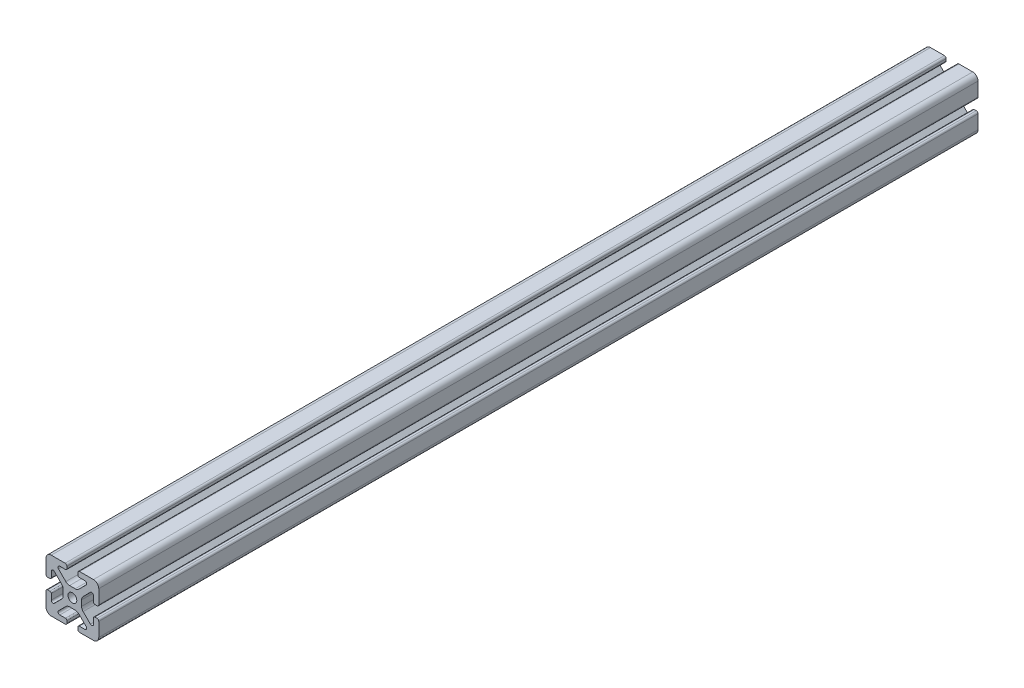
from build123d import *

# Parameters (mm, degrees)
SKETCH1_R           = 2.5
BOSS_EXTRUDE1_DEPTH = 500


with BuildPart() as part:
    # Sketch1 → Boss-Extrude1 (new body)
    with BuildSketch(Plane.XY):
        with BuildLine():
            Line((1.603196264, 5.250000001), (-1.603196256, 5.250000001))
            ThreePointArc((-1.603196256, 5.250000001), (-2.751246551, 5.478361403), (-3.724516596, 6.128679656))
            Line((-3.724516596, 6.128679656), (-7.850557356, 10.254720416))
            ThreePointArc((-7.850557356, 10.254720416), (-8.072177387, 11.368879549), (-7.127638883, 12))
            Line((-7.127638883, 12), (-3.899999993, 12))
            ThreePointArc((-3.899999993, 12), (-3.334314568, 12.234314575), (-3.099999993, 12.8))
            Line((-3.099999993, 12.8), (-3.099999993, 14))
            ThreePointArc((-3.099999993, 14), (-3.392893211, 14.707106781), (-4.099999993, 15))
            Line((-4.099999993, 15), (-11.999999993, 15))
            ThreePointArc((-11.999999993, 15), (-14.121320336, 14.121320343), (-14.999999993, 12))
            Line((-14.999999993, 12), (-14.999999993, 4.1))
            ThreePointArc((-14.999999993, 4.1), (-14.707106774, 3.392893219), (-13.999999993, 3.1))
            Line((-13.999999993, 3.1), (-12.799999993, 3.1))
            ThreePointArc((-12.799999993, 3.1), (-12.234314568, 3.334314575), (-11.999999993, 3.9))
            Line((-11.999999993, 3.9), (-11.999999993, 7.12763889))
            ThreePointArc((-11.999999993, 7.12763889), (-11.368879545, 8.072177389), (-10.254720418, 7.85055736))
            Line((-10.254720418, 7.85055736), (-6.128679658, 3.7245166))
            ThreePointArc((-6.128679658, 3.7245166), (-5.478361404, 2.751246553), (-5.250000001, 1.603196256))
            Line((-5.250000001, 1.603196256), (-5.250000001, -1.603196264))
            ThreePointArc((-5.250000001, -1.603196264), (-5.478361403, -2.751246559), (-6.128679656, -3.724516604))
            Line((-6.128679656, -3.724516604), (-10.254720416, -7.850557364))
            ThreePointArc((-10.254720416, -7.850557364), (-11.368879549, -8.072177394), (-12, -7.12763889))
            Line((-12, -7.12763889), (-12, -3.9))
            ThreePointArc((-12, -3.9), (-12.234314575, -3.334314575), (-12.8, -3.1))
            Line((-12.8, -3.1), (-14, -3.1))
            ThreePointArc((-14, -3.1), (-14.707106781, -3.392893219), (-15, -4.1))
            Line((-15, -4.1), (-15, -12))
            ThreePointArc((-15, -12), (-14.121320344, -14.121320344), (-12, -15))
            Line((-12, -15), (-4.1, -15))
            ThreePointArc((-4.1, -15), (-3.392893219, -14.707106781), (-3.1, -14))
            Line((-3.1, -14), (-3.1, -12.8))
            ThreePointArc((-3.1, -12.8), (-3.334314575, -12.234314575), (-3.9, -12))
            Line((-3.9, -12), (-7.12763889, -12))
            ThreePointArc((-7.12763889, -12), (-8.07217739, -11.368879552), (-7.85055736, -10.254720425))
            Line((-7.85055736, -10.254720425), (-3.7245166, -6.128679665))
            ThreePointArc((-3.7245166, -6.128679665), (-2.751246554, -5.478361411), (-1.603196256, -5.250000009))
            Line((-1.603196256, -5.250000009), (1.603196264, -5.250000009))
            ThreePointArc((1.603196264, -5.250000009), (2.751246559, -5.478361411), (3.724516604, -6.128679664))
            Line((3.724516604, -6.128679664), (7.850557364, -10.254720424))
            ThreePointArc((7.850557364, -10.254720424), (8.072177394, -11.368879556), (7.12763889, -12.000000007))
            Line((7.12763889, -12.000000007), (3.9, -12.000000007))
            ThreePointArc((3.9, -12.000000007), (3.334314575, -12.234314583), (3.1, -12.800000007))
            Line((3.1, -12.800000007), (3.1, -14.000000007))
            ThreePointArc((3.1, -14.000000007), (3.392893219, -14.707106789), (4.1, -15.000000007))
            Line((4.1, -15.000000007), (12, -15.000000007))
            ThreePointArc((12, -15.000000007), (14.121320343, -14.121320351), (15, -12.000000007))
            Line((15, -12.000000007), (15, -4.100000007))
            ThreePointArc((15, -4.100000007), (14.707106781, -3.392893226), (14, -3.100000007))
            Line((14, -3.100000007), (12.8, -3.100000007))
            ThreePointArc((12.8, -3.100000007), (12.234314575, -3.334314583), (12, -3.900000007))
            Line((12, -3.900000007), (12, -7.127638897))
            ThreePointArc((12, -7.127638897), (11.368879552, -8.072177397), (10.254720425, -7.850557367))
            Line((10.254720425, -7.850557367), (6.128679665, -3.724516607))
            ThreePointArc((6.128679665, -3.724516607), (5.478361411, -2.751246561), (5.250000009, -1.603196264))
            Line((5.250000009, -1.603196264), (5.250000009, 1.603196256))
            ThreePointArc((5.250000009, 1.603196256), (5.478361411, 2.751246551), (6.128679664, 3.724516596))
            Line((6.128679664, 3.724516596), (10.254720424, 7.850557356))
            ThreePointArc((10.254720424, 7.850557356), (11.368879556, 8.072177387), (12.000000007, 7.127638882))
            Line((12.000000007, 7.127638882), (12.000000007, 3.899999992))
            ThreePointArc((12.000000007, 3.899999992), (12.234314582, 3.334314567), (12.800000007, 3.099999992))
            Line((12.800000007, 3.099999992), (14.000000007, 3.099999992))
            ThreePointArc((14.000000007, 3.099999992), (14.707106788, 3.392893211), (15.000000007, 4.099999992))
            Line((15.000000007, 4.099999992), (15.000000007, 11.999999992))
            ThreePointArc((15.000000007, 11.999999992), (14.121320351, 14.121320336), (12.000000007, 14.999999992))
            Line((12.000000007, 14.999999992), (4.100000007, 14.999999992))
            ThreePointArc((4.100000007, 14.999999992), (3.392893226, 14.707106774), (3.100000007, 13.999999992))
            Line((3.100000007, 13.999999992), (3.100000007, 12.799999992))
            ThreePointArc((3.100000007, 12.799999992), (3.334314582, 12.234314567), (3.900000007, 11.999999992))
            Line((3.900000007, 11.999999992), (7.127638897, 11.999999992))
            ThreePointArc((7.127638897, 11.999999992), (8.072177397, 11.368879544), (7.850557367, 10.254720418))
            Line((7.850557367, 10.254720418), (3.724516607, 6.128679658))
            ThreePointArc((3.724516607, 6.128679658), (2.751246561, 5.478361404), (1.603196264, 5.250000001))
        make_face()
        Circle(SKETCH1_R, mode=Mode.SUBTRACT)
    extrude(amount=BOSS_EXTRUDE1_DEPTH)


solid = part.part
